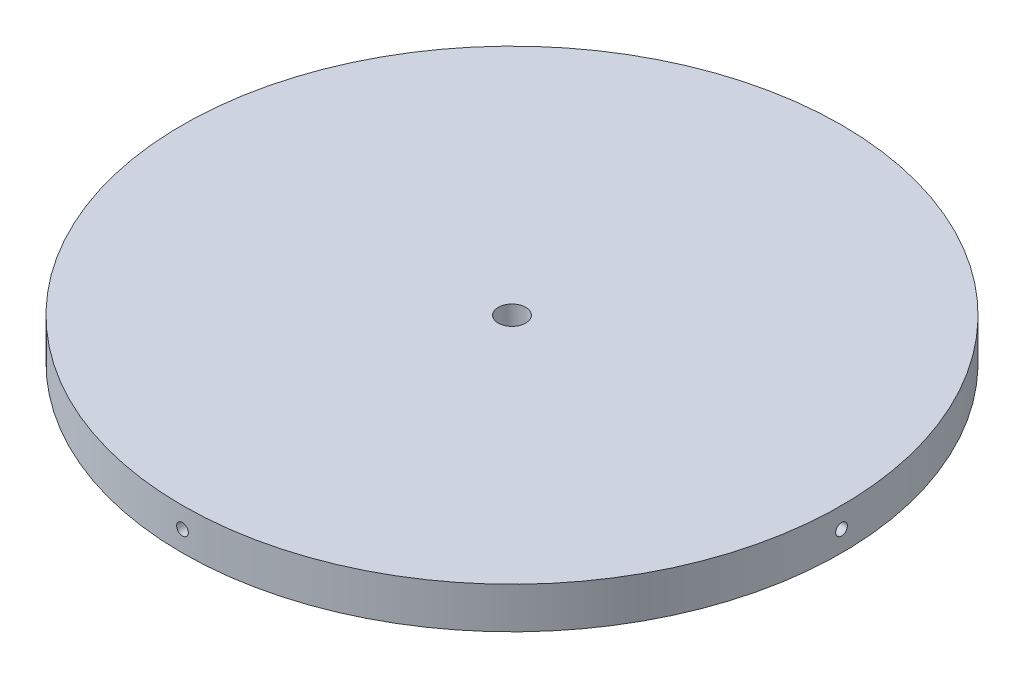
from build123d import *

# Parameters (mm, degrees)
SKETCH1_R           = 76.1746
SKETCH1_R_2         = 3.175
BOSS_EXTRUDE1_DEPTH = 9.525
CIRPATTERN1_COUNT   = 4


with BuildPart() as part:
    # Sketch1 → Boss-Extrude1 (new body)
    with BuildSketch(Plane(origin=(0, 0, 0), x_dir=(1, 0, 0), z_dir=(0, 1, 0))):
        Circle(SKETCH1_R)
        Circle(SKETCH1_R_2, mode=Mode.SUBTRACT)
    extrude(amount=BOSS_EXTRUDE1_DEPTH)

    # Sketch3 → Tap Drill for #6-32 Tap1 (revolve, cut)
    with BuildSketch(Plane(origin=(0, 4.7625, -76.1746), x_dir=(0, 1, 0), z_dir=(1, 0, 0))):
        Polygon((0, 0), (0, 10.46469403), (1.35255, 9.652), (1.35255, 0), align=None)
    tap_drill_for_6_32_tap1 = revolve(axis=Axis((0, 4.7625, -82.5246), (0, 0, 1)), mode=Mode.SUBTRACT)

    # CirPattern1: Tap Drill for #6-32 Tap1 ×4 about axis
    cirpattern1_axis = Axis((0, 9.525, 0), (0, 1, 0))
    for i in range(1, CIRPATTERN1_COUNT):
        add(tap_drill_for_6_32_tap1.rotate(cirpattern1_axis, i * 360 / CIRPATTERN1_COUNT), mode=Mode.SUBTRACT)


solid = part.part
